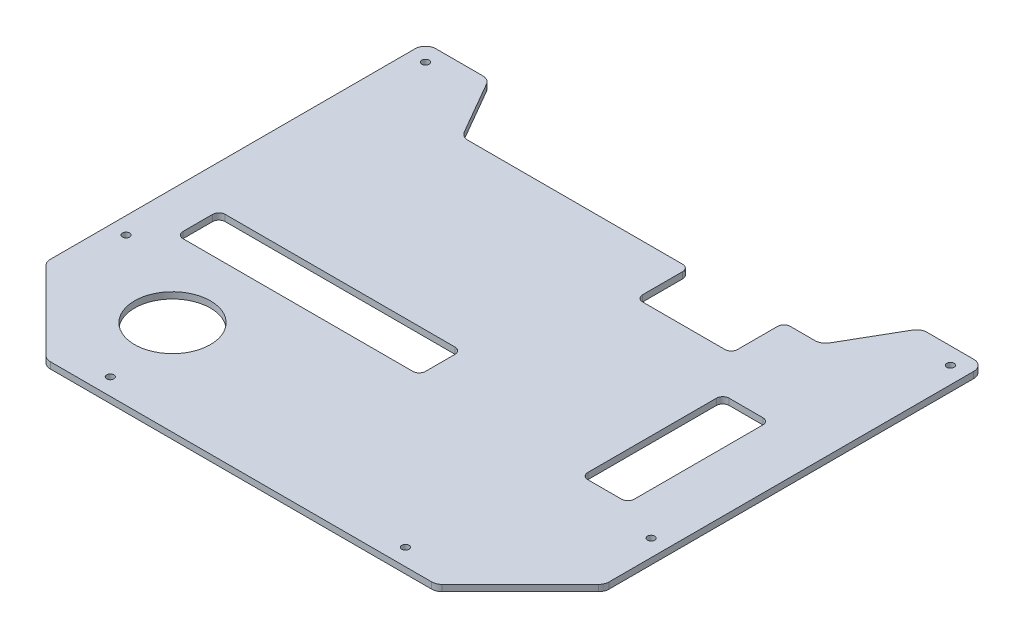
from build123d import *

# Parameters (mm, degrees)
BOSS_EXTRU_1_DEPTH      = 3
CONG_1_R                = 5
ESQUISSE2_R             = 1
ENL_V_MAT_EXTRU_1_DEPTH = 257.837010573
D_GAGEMENT_M31_D        = 3.4
ESQUISSE5_R             = 18
ESQUISSE5_W             = 45
ESQUISSE5_H             = 25
ESQUISSE5_W_2           = 115
ESQUISSE5_H_2           = 20
ESQUISSE5_W_3           = 22
ESQUISSE5_H_3           = 67
ENL_V_MAT_EXTRU_2_DEPTH = 257.837010573
CONG_2_R                = 3


with BuildPart() as part:
    # Esquisse1 → Boss.-Extru.1 (new body)
    with BuildSketch(Plane(origin=(0, 0, 0), x_dir=(1, 0, 0), z_dir=(0, 1, 0))):
        Polygon((-92.5, 0), (92.5, 0), (132.5, 40), (132.5, 220), (102.5, 220), (85.179491924, 190), (-85.179491924, 190), (-102.5, 220), (-132.5, 220), (-132.5, 40), align=None)
    extrude(amount=BOSS_EXTRU_1_DEPTH)

    # Congé1
    cong_1_edges = [part.edges().sort_by_distance(p)[0] for p in [
        (132.5, 1.5, -220),
        (102.5, 1.5, -220),
        (85.179491924, 1.5, -190),
        (-85.179491924, 1.5, -190),
        (-102.5, 1.5, -220),
        (-132.5, 1.5, -220),
        (-132.5, 1.5, -40),
        (-92.5, 1.5, 0),
        (92.5, 1.5, 0),
        (132.5, 1.5, -40),
    ]]
    fillet(cong_1_edges, radius=CONG_1_R)

    # Esquisse2 → Enlèv. mat.-Extru.1 (cut, through all)
    with BuildSketch(Plane.XZ):
        with Locations((-70, -8)):
            Circle(ESQUISSE2_R)
        with Locations((-124.5, -70)):
            Circle(ESQUISSE2_R)
        with Locations((-124.5, -212)):
            Circle(ESQUISSE2_R)
        with Locations((124.5, -212)):
            Circle(ESQUISSE2_R)
        with Locations((124.5, -70)):
            Circle(ESQUISSE2_R)
        with Locations((70, -8)):
            Circle(ESQUISSE2_R)
    extrude(amount=-ENL_V_MAT_EXTRU_1_DEPTH, mode=Mode.SUBTRACT)

    # Dégagement M31 (through all)
    with Locations(Plane(origin=(0, 0, 0), x_dir=(-1, 0, 0), z_dir=(0, -1, 0))):
        with Locations((-70, 8), (-124.5, 70), (-124.5, 212), (124.5, 212), (124.5, 70), (70, 8)):
            Hole(D_GAGEMENT_M31_D / 2)

    # Esquisse5 → Enlèv. mat.-Extru.2 (cut, through all)
    with BuildSketch(Plane.XZ):
        with Locations((-77.5, -45)):
            Circle(ESQUISSE5_R)
        with Locations((45, -177.5)):
            Rectangle(ESQUISSE5_W, ESQUISSE5_H)
        with Locations((-55, -92)):
            Rectangle(ESQUISSE5_W_2, ESQUISSE5_H_2)
        with Locations((93.5, -112.5)):
            Rectangle(ESQUISSE5_W_3, ESQUISSE5_H_3)
    extrude(amount=-ENL_V_MAT_EXTRU_2_DEPTH, mode=Mode.SUBTRACT)

    # Congé2
    cong_2_edges = [part.edges().sort_by_distance(p)[0] for p in [
        (67.5, 1.5, -190),
        (67.5, 1.5, -165),
        (22.5, 1.5, -165),
        (22.5, 1.5, -190),
        (104.5, 1.5, -146),
        (82.5, 1.5, -146),
        (82.5, 1.5, -79),
        (104.5, 1.5, -79),
        (2.5, 1.5, -82),
        (2.5, 1.5, -102),
        (-112.5, 1.5, -82),
        (-112.5, 1.5, -102),
    ]]
    fillet(cong_2_edges, radius=CONG_2_R)


solid = part.part
